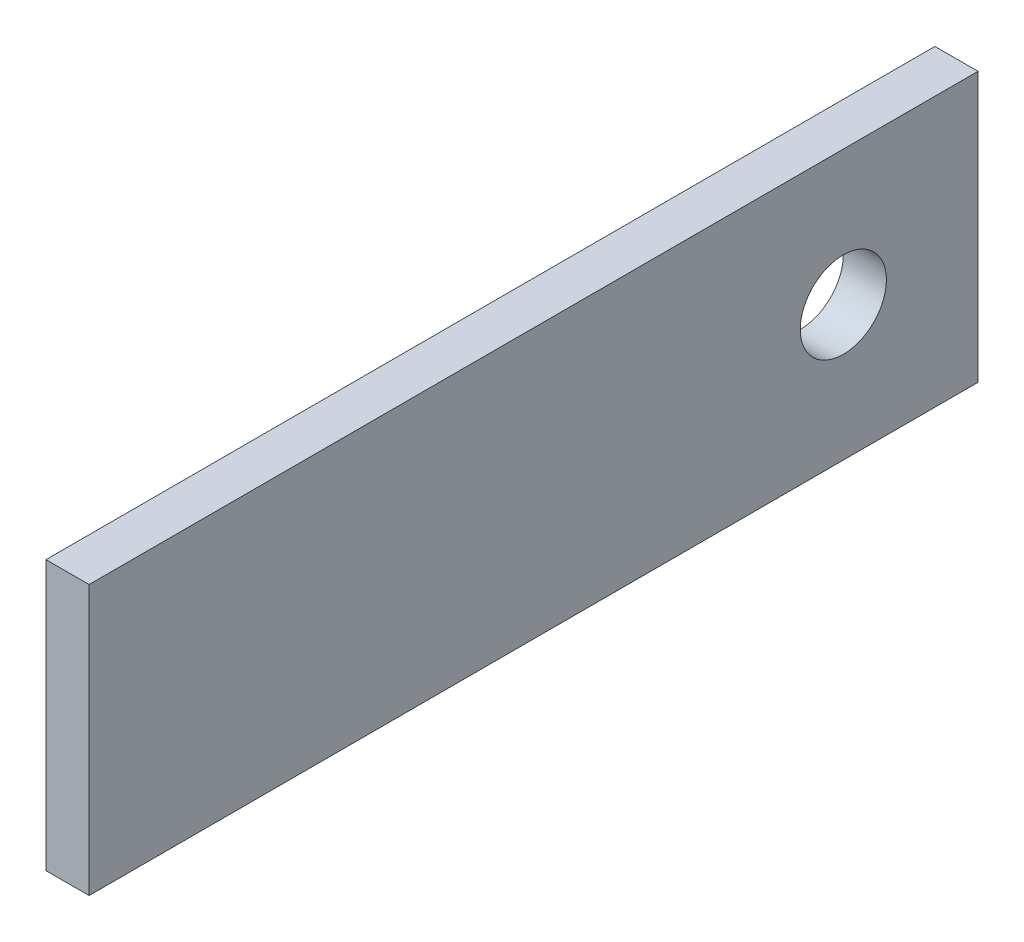
from build123d import *

# Parameters (mm, degrees)
SKETCH1_W           = 82.5
SKETCH1_H           = 25
SKETCH1_R           = 4
BOSS_EXTRUDE1_DEPTH = 4


with BuildPart() as part:
    # Sketch1 → Boss-Extrude1 (new body)
    with BuildSketch(Plane(origin=(0, 0, 0), x_dir=(0, 0, -1), z_dir=(1, 0, 0))):
        with Locations((-28.75, 0)):
            Rectangle(SKETCH1_W, SKETCH1_H)
        Circle(SKETCH1_R, mode=Mode.SUBTRACT)
    extrude(amount=BOSS_EXTRUDE1_DEPTH)


solid = part.part
